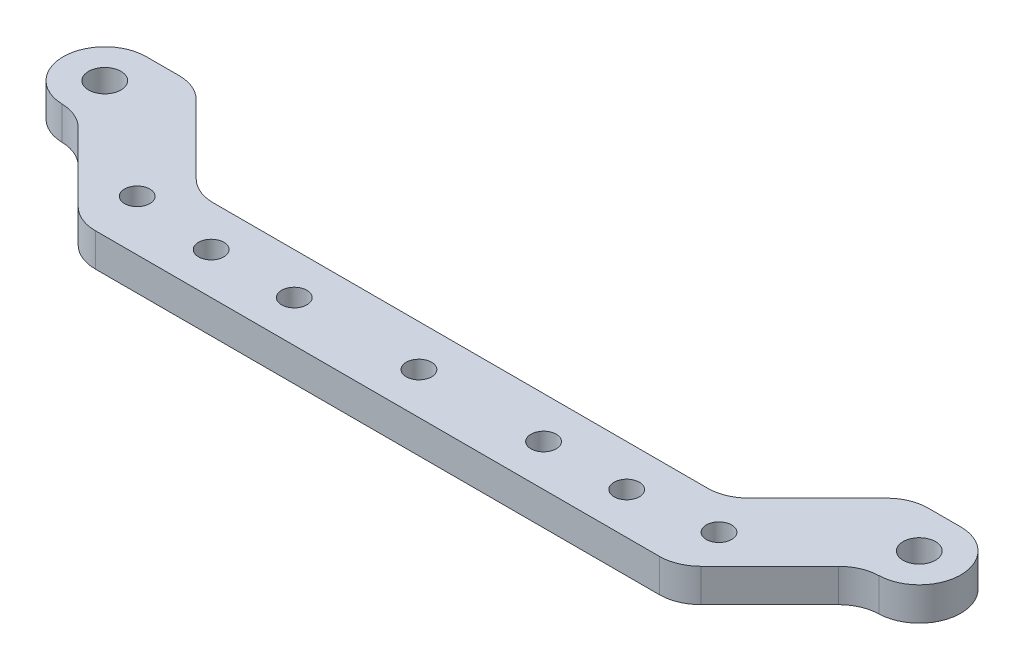
from build123d import *

# Parameters (mm, degrees)
BOSS_EXTRUDE1_START = 6.3
SKETCH1_R           = 1.95
BOSS_EXTRUDE1_DEPTH = 4
CHAMFER1_SIZE       = 13
CHAMFER2_SIZE       = 13
FILLET1_R           = 5
SKETCH2_R           = 1.525
CUT_EXTRUDE1_DEPTH  = 62.410503988


with BuildPart() as part:
    # Sketch1 → Boss-Extrude1 (new body)
    with BuildSketch(Plane(origin=(0, 0, 0), x_dir=(1, 0, 0), z_dir=(0, 1, 0)).offset(BOSS_EXTRUDE1_START)):
        with BuildLine():
            Line((-54.1, -5), (-54.1, -16.2))
            Line((-54.1, -16.2), (43.9, -16.2))
            Line((43.9, -16.2), (43.9, -5))
            ThreePointArc((43.9, -5), (48.9, 0), (43.9, 5))
            Line((43.9, 5), (24.9, 5))
            Line((24.9, 5), (24.9, -6.2))
            Line((24.9, -6.2), (-35.1, -6.2))
            Line((-35.1, -6.2), (-35.1, 5))
            Line((-35.1, 5), (-54.1, 5))
            ThreePointArc((-54.1, 5), (-59.1, 0), (-54.1, -5))
        make_face()
        with Locations(Location((43.9, 0, 0), (0, 0, 90))):
            Circle(SKETCH1_R, mode=Mode.SUBTRACT)
        with Locations(Location((-54.1, 0, 0), (0, 0, 90))):
            Circle(SKETCH1_R, mode=Mode.SUBTRACT)
    extrude(amount=BOSS_EXTRUDE1_DEPTH)

    # Chamfer1
    # the kernel refuses this chamfer: 13 mm, written as the material it takes off along each edge
    with BuildSketch(Plane(origin=(24.9, -27.131878844, -5), x_dir=(0.9996219169112968, 0, -0.027495876610586358), z_dir=(0, 1, 0))) as chamfer1_piece_1_section:
        Polygon((CHAMFER1_SIZE * 0.999621916911, -CHAMFER1_SIZE * 0.0274958766106), (-CHAMFER1_SIZE * 0.0274958766106, -CHAMFER1_SIZE * 0.999621916911), (0, 0), align=None)
    chamfer1_piece_1 = extrude(amount=70.863757687, mode=Mode.PRIVATE)
    chamfer1_piece_1 = split(chamfer1_piece_1, bisect_by=Plane(origin=(29.309865353, 8.3, 6.2), z_dir=(0, 0, -1)), keep=Keep.TOP, mode=Mode.PRIVATE)
    add(chamfer1_piece_1, mode=Mode.SUBTRACT)
    with BuildSketch(Plane(origin=(-35.1, -27.131878844, -5), x_dir=(0.027495876610586424, 0, 0.9996219169112968), z_dir=(0, 1, 0))) as chamfer1_piece_2_section:
        Polygon((CHAMFER1_SIZE * 0.999621916911, -CHAMFER1_SIZE * 0.0274958766106), (-CHAMFER1_SIZE * 0.0274958766106, -CHAMFER1_SIZE * 0.999621916911), (0, 0), align=None)
    chamfer1_piece_2 = extrude(amount=70.863757687, mode=Mode.PRIVATE)
    chamfer1_piece_2 = split(chamfer1_piece_2, bisect_by=Plane(origin=(-39.509865353, 8.3, 6.2), z_dir=(0, 0, -1)), keep=Keep.TOP, mode=Mode.PRIVATE)
    add(chamfer1_piece_2, mode=Mode.SUBTRACT)

    # Chamfer2
    # the kernel refuses this chamfer: 13 mm, written as the material it takes off along each edge
    with BuildSketch(Plane(origin=(43.9, -27.131878844, 16.2), x_dir=(0.02749587661058749, 0, -0.9996219169112966), z_dir=(0, 1, 0))) as chamfer2_piece_1_section:
        Polygon((CHAMFER2_SIZE * 0.999621916911, CHAMFER2_SIZE * 0.0274958766106), (-CHAMFER2_SIZE * 0.0274958766106, CHAMFER2_SIZE * 0.999621916911), (0, 0), align=None)
    chamfer2_piece_1 = extrude(amount=70.863757687, mode=Mode.PRIVATE)
    chamfer2_piece_1 = chamfer2_piece_1 - Plane(origin=(43.9, 8.3, 0), x_dir=(0, 0, 1), z_dir=(0, -1, 0)) * Cylinder(5, 194, mode=Mode.PRIVATE)
    add(chamfer2_piece_1, mode=Mode.SUBTRACT)
    with BuildSketch(Plane(origin=(-54.1, -27.131878844, 16.2), x_dir=(-0.027495876610587482, 0, -0.9996219169112966), z_dir=(0, 1, 0))) as chamfer2_piece_2_section:
        Polygon((CHAMFER2_SIZE * 0.999621916911, -CHAMFER2_SIZE * 0.0274958766106), (-CHAMFER2_SIZE * 0.0274958766106, -CHAMFER2_SIZE * 0.999621916911), (0, 0), align=None)
    chamfer2_piece_2 = extrude(amount=70.863757687, mode=Mode.PRIVATE)
    chamfer2_piece_2 = chamfer2_piece_2 - Plane(origin=(-54.1, 8.3, 0), x_dir=(0, 0, -1), z_dir=(0, -1, 0)) * Cylinder(5, 194, mode=Mode.PRIVATE)
    add(chamfer2_piece_2, mode=Mode.SUBTRACT)

    # Fillet1
    fillet1_edges = [part.edges().sort_by_distance(p)[0] for p in [
        (42.347223446, 8.3, 4.752776554),
        (-52.547223446, 8.3, 4.752776554),
        (37.9, 8.3, -5),
        (-48.1, 8.3, -5),
        (26.7, 8.3, 6.2),
        (-36.9, 8.3, 6.2),
        (-41.1, 8.3, 16.2),
        (30.9, 8.3, 16.2),
    ]]
    fillet(fillet1_edges, radius=FILLET1_R)

    # Sketch2 → Cut-Extrude1 (cut, through all)
    with BuildSketch(Plane(origin=(0, 10.3, 0), x_dir=(1, 0, 0), z_dir=(0, 1, 0))):
        with Locations(Location((29.9, -10.1, 0), (0, 0, 270))):
            Circle(SKETCH2_R)
        with Locations(Location((-5.1, -11.2, 0), (0, 0, 270))):
            Circle(SKETCH2_R)
        with Locations(Location((9.9, -11.2, 0), (0, 0, 270))):
            Circle(SKETCH2_R)
        with Locations(Location((-40.1, -10.1, 0), (0, 0, 90))):
            Circle(SKETCH2_R)
        with Locations(Location((-20.1, -11.2, 0), (0, 0, 90))):
            Circle(SKETCH2_R)
        with Locations(Location((19.9, -11.2, 0), (0, 0, 270))):
            Circle(SKETCH2_R)
        with Locations(Location((-30.1, -11.2, 0), (0, 0, 90))):
            Circle(SKETCH2_R)
    extrude(amount=-CUT_EXTRUDE1_DEPTH, mode=Mode.SUBTRACT)


solid = part.part
